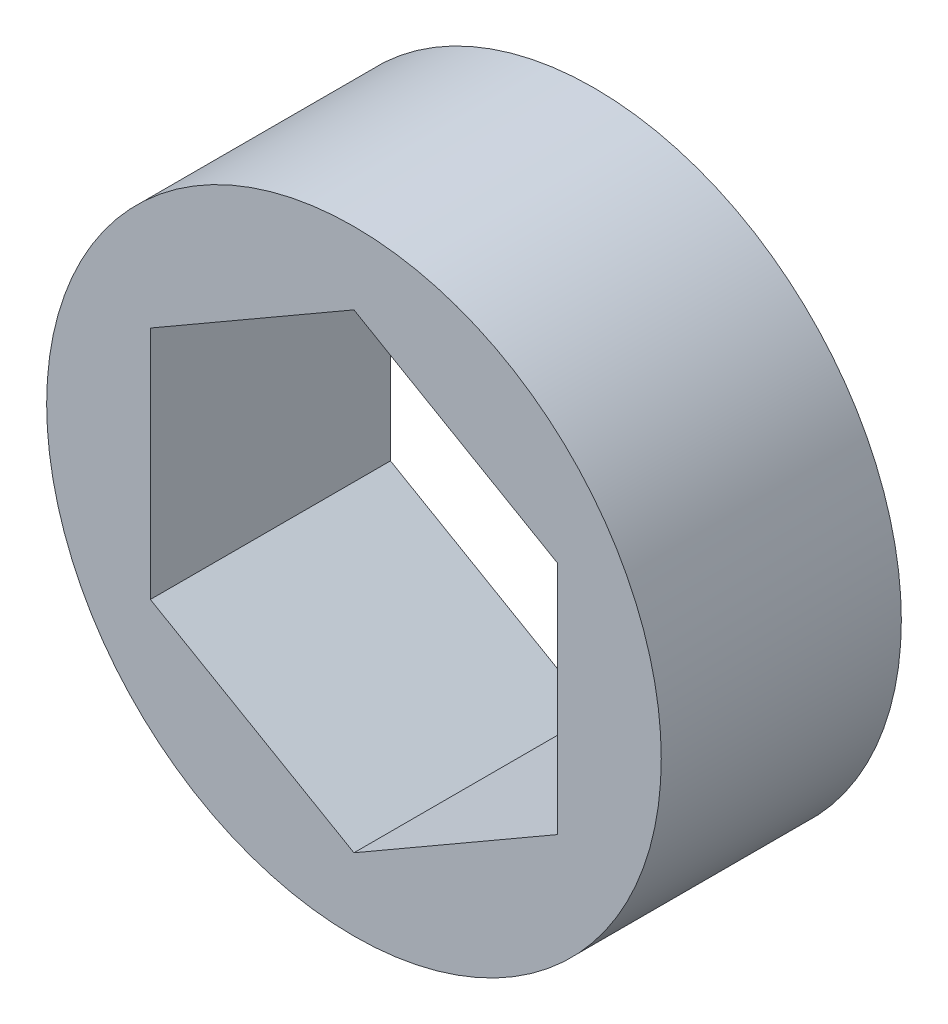
from build123d import *

# Parameters (mm, degrees)
SKETCH1_R           = 10.16
BOSS_EXTRUDE1_DEPTH = 3.96875


with BuildPart() as part:
    # Sketch1 → Boss-Extrude1 (new, symmetric)
    with BuildSketch(Plane.XY):
        Circle(SKETCH1_R)
        Polygon((0, 7.772289324), (-6.731, 3.886144662), (-6.731, -3.886144662), (0, -7.772289324), (6.731, -3.886144662), (6.731, 3.886144662), align=None, mode=Mode.SUBTRACT)
    extrude(amount=BOSS_EXTRUDE1_DEPTH, both=True)


solid = part.part
